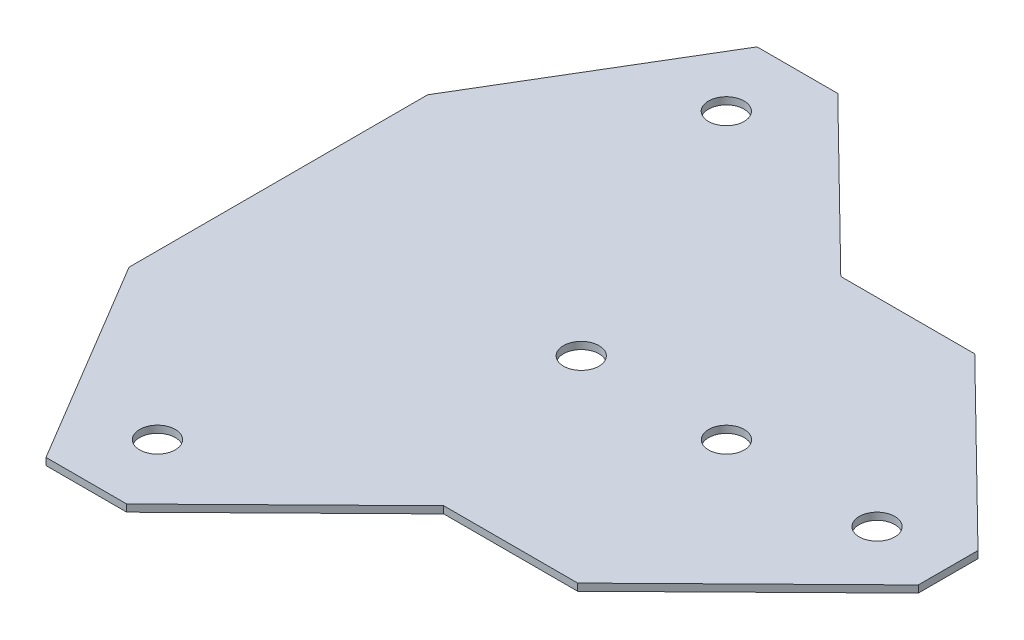
from build123d import *

# Parameters (mm, degrees)
SKETCH1_R          = 2.5
BASE_FLANGE1_DEPTH = 1


# Sheet-metal steps are written as plain solids
with BuildPart() as part:
    # Sketch1 → Base-Flange1 (new body)
    with BuildSketch(Plane(origin=(0, 0, 0), x_dir=(1, 0, 0), z_dir=(0, 1, 0))):
        Polygon((5.674376272, 50), (28.180948875, 27.92), (47.02, 27.92), (71.2, 4.198289483), (71.2, -4.198289483), (47.02, -27.92), (28.180948875, -27.92), (5.674376272, -50), (-5.674376272, -50), (-23, -21), (-23, 21), (-5.674376272, 50), align=None)
        with Locations(Location((0, 40, 0), (0, 0, 270))):
            Circle(SKETCH1_R, mode=Mode.SUBTRACT)
        with Locations(Location((0, -40, 0), (0, 0, 90))):
            Circle(SKETCH1_R, mode=Mode.SUBTRACT)
        with Locations(Location((61.2, 0, 0), (0, 0, 270))):
            Circle(SKETCH1_R, mode=Mode.SUBTRACT)
        with Locations(Location((19.6, 0, 0), (0, 0, 270))):
            Circle(SKETCH1_R, mode=Mode.SUBTRACT)
        with Locations(Location((40.02, 0, 0), (0, 0, 270))):
            Circle(SKETCH1_R, mode=Mode.SUBTRACT)
    extrude(amount=-BASE_FLANGE1_DEPTH)


solid = part.part
